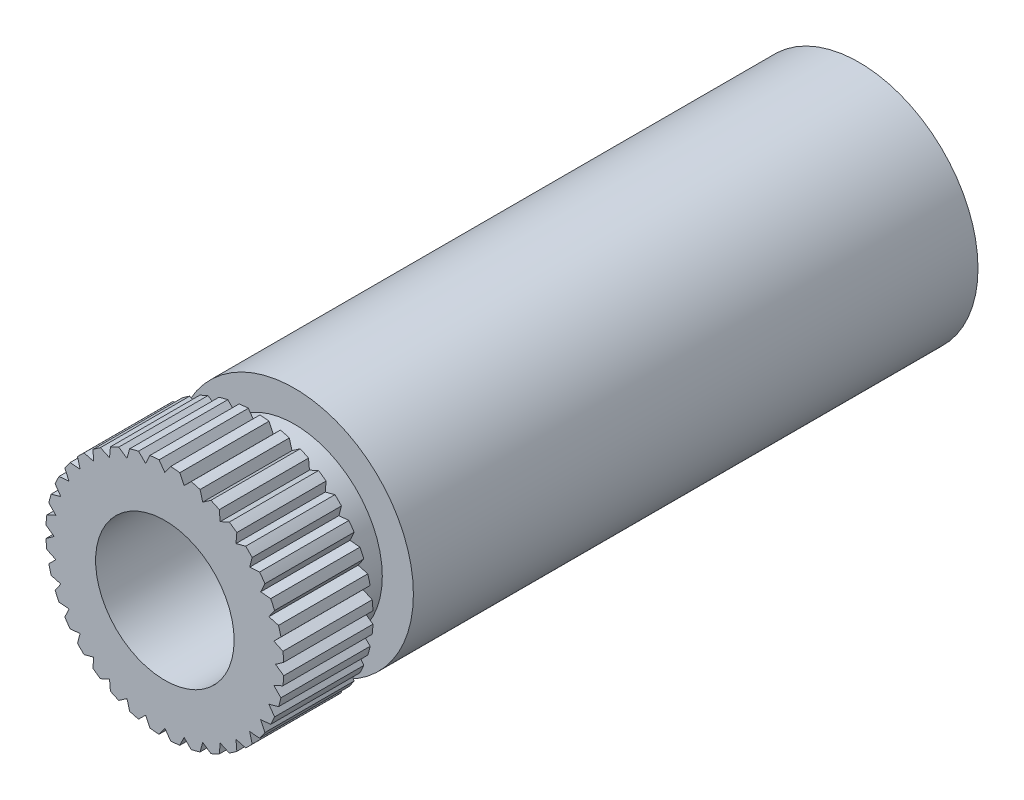
from build123d import *

# Parameters (mm, degrees)
SKETCH1_R           = 6
BOSS_EXTRUDE1_DEPTH = 35
SKETCH4_OUTSIDE_W   = 21.78
SKETCH4_OUTSIDE_H   = 21.78
CUT_EXTRUDE5_DEPTH  = 4.5
SKETCH6_R           = 6.880488524
SKETCH6_R_2         = 4.4323
CUT_EXTRUDE6_DEPTH  = 2.032
SKETCH7_R           = 3.4925
CUT_EXTRUDE7_DEPTH  = 7.112


with BuildPart() as part:
    # Sketch1 → Boss-Extrude1 (new body)
    with BuildSketch(Plane.XY):
        Circle(SKETCH1_R)
    extrude(amount=-BOSS_EXTRUDE1_DEPTH)

    # Sketch4 outside → Cut-Extrude5 (cut)
    with BuildSketch(Plane.XY):
        Rectangle(SKETCH4_OUTSIDE_W, SKETCH4_OUTSIDE_H)
        with BuildLine():
            Line((5.5808372, 0), (5.992919203, 0.291409379))
            ThreePointArc((5.992919203, 0.291409379), (5.977168189, 0.522934456), (5.952476002, 0.753677283))
            Line((5.952476002, 0.753677283), (5.496051743, 0.96910221))
            Line((5.496051743, 0.96910221), (5.851270587, 1.327641714))
            ThreePointArc((5.851270587, 1.327641714), (5.795554958, 1.552914271), (5.73116983, 1.775863842))
            Line((5.73116983, 1.775863842), (5.244271535, 1.908758739))
            Line((5.244271535, 1.908758739), (5.531834074, 2.323534328))
            ThreePointArc((5.531834074, 2.323534328), (5.437846722, 2.53570957), (5.335724962, 2.744091676))
            Line((5.335724962, 2.744091676), (4.83314679, 2.7904186))
            Line((4.83314679, 2.7904186), (5.044315583, 3.248827527))
            ThreePointArc((5.044315583, 3.248827527), (4.914912266, 3.441458618), (4.778156792, 3.628941674))
            Line((4.778156792, 3.628941674), (4.275169325, 3.587293004))
            Line((4.275169325, 3.587293004), (4.403528115, 4.075406745))
            ThreePointArc((4.403528115, 4.075406745), (4.242640687, 4.242640687), (4.075406745, 4.403528115))
            Line((4.075406745, 4.403528115), (3.587293004, 4.275169325))
            Line((3.587293004, 4.275169325), (3.628941674, 4.778156792))
            ThreePointArc((3.628941674, 4.778156792), (3.441458618, 4.914912266), (3.248827527, 5.044315583))
            Line((3.248827527, 5.044315583), (2.7904186, 4.83314679))
            Line((2.7904186, 4.83314679), (2.744091676, 5.335724962))
            ThreePointArc((2.744091676, 5.335724962), (2.53570957, 5.437846722), (2.323534328, 5.531834074))
            Line((2.323534328, 5.531834074), (1.908758739, 5.244271535))
            Line((1.908758739, 5.244271535), (1.775863842, 5.73116983))
            ThreePointArc((1.775863842, 5.73116983), (1.552914271, 5.795554958), (1.327641714, 5.851270587))
            Line((1.327641714, 5.851270587), (0.96910221, 5.496051743))
            Line((0.96910221, 5.496051743), (0.753677283, 5.952476002))
            ThreePointArc((0.753677283, 5.952476002), (0.522934456, 5.977168189), (0.291409379, 5.992919203))
            Line((0.291409379, 5.992919203), (0, 5.5808372))
            Line((0, 5.5808372), (-0.291409379, 5.992919203))
            ThreePointArc((-0.291409379, 5.992919203), (-0.522934456, 5.977168189), (-0.753677283, 5.952476002))
            Line((-0.753677283, 5.952476002), (-0.96910221, 5.496051743))
            Line((-0.96910221, 5.496051743), (-1.327641714, 5.851270587))
            ThreePointArc((-1.327641714, 5.851270587), (-1.552914271, 5.795554958), (-1.775863842, 5.73116983))
            Line((-1.775863842, 5.73116983), (-1.908758739, 5.244271535))
            Line((-1.908758739, 5.244271535), (-2.323534328, 5.531834074))
            ThreePointArc((-2.323534328, 5.531834074), (-2.53570957, 5.437846722), (-2.744091676, 5.335724962))
            Line((-2.744091676, 5.335724962), (-2.7904186, 4.83314679))
            Line((-2.7904186, 4.83314679), (-3.248827527, 5.044315583))
            ThreePointArc((-3.248827527, 5.044315583), (-3.441458618, 4.914912266), (-3.628941674, 4.778156792))
            Line((-3.628941674, 4.778156792), (-3.587293004, 4.275169325))
            Line((-3.587293004, 4.275169325), (-4.075406745, 4.403528115))
            ThreePointArc((-4.075406745, 4.403528115), (-4.242640687, 4.242640687), (-4.403528115, 4.075406745))
            Line((-4.403528115, 4.075406745), (-4.275169325, 3.587293004))
            Line((-4.275169325, 3.587293004), (-4.778156792, 3.628941674))
            ThreePointArc((-4.778156792, 3.628941674), (-4.914912266, 3.441458618), (-5.044315583, 3.248827527))
            Line((-5.044315583, 3.248827527), (-4.83314679, 2.7904186))
            Line((-4.83314679, 2.7904186), (-5.335724962, 2.744091676))
            ThreePointArc((-5.335724962, 2.744091676), (-5.437846722, 2.53570957), (-5.531834074, 2.323534328))
            Line((-5.531834074, 2.323534328), (-5.244271535, 1.908758739))
            Line((-5.244271535, 1.908758739), (-5.73116983, 1.775863842))
            ThreePointArc((-5.73116983, 1.775863842), (-5.795554958, 1.552914271), (-5.851270587, 1.327641714))
            Line((-5.851270587, 1.327641714), (-5.496051743, 0.96910221))
            Line((-5.496051743, 0.96910221), (-5.952476002, 0.753677283))
            ThreePointArc((-5.952476002, 0.753677283), (-5.977168189, 0.522934456), (-5.992919203, 0.291409379))
            Line((-5.992919203, 0.291409379), (-5.5808372, 0))
            Line((-5.5808372, 0), (-5.992919203, -0.291409379))
            ThreePointArc((-5.992919203, -0.291409379), (-5.977168189, -0.522934456), (-5.952476002, -0.753677283))
            Line((-5.952476002, -0.753677283), (-5.496051743, -0.96910221))
            Line((-5.496051743, -0.96910221), (-5.851270587, -1.327641714))
            ThreePointArc((-5.851270587, -1.327641714), (-5.795554958, -1.552914271), (-5.73116983, -1.775863842))
            Line((-5.73116983, -1.775863842), (-5.244271535, -1.908758739))
            Line((-5.244271535, -1.908758739), (-5.531834074, -2.323534328))
            ThreePointArc((-5.531834074, -2.323534328), (-5.437846722, -2.53570957), (-5.335724962, -2.744091676))
            Line((-5.335724962, -2.744091676), (-4.83314679, -2.7904186))
            Line((-4.83314679, -2.7904186), (-5.044315583, -3.248827527))
            ThreePointArc((-5.044315583, -3.248827527), (-4.914912266, -3.441458618), (-4.778156792, -3.628941674))
            Line((-4.778156792, -3.628941674), (-4.275169325, -3.587293004))
            Line((-4.275169325, -3.587293004), (-4.403528115, -4.075406745))
            ThreePointArc((-4.403528115, -4.075406745), (-4.242640687, -4.242640687), (-4.075406745, -4.403528115))
            Line((-4.075406745, -4.403528115), (-3.587293004, -4.275169325))
            Line((-3.587293004, -4.275169325), (-3.628941674, -4.778156792))
            ThreePointArc((-3.628941674, -4.778156792), (-3.441458618, -4.914912266), (-3.248827527, -5.044315583))
            Line((-3.248827527, -5.044315583), (-2.7904186, -4.83314679))
            Line((-2.7904186, -4.83314679), (-2.744091676, -5.335724962))
            ThreePointArc((-2.744091676, -5.335724962), (-2.53570957, -5.437846722), (-2.323534328, -5.531834074))
            Line((-2.323534328, -5.531834074), (-1.908758739, -5.244271535))
            Line((-1.908758739, -5.244271535), (-1.775863842, -5.73116983))
            ThreePointArc((-1.775863842, -5.73116983), (-1.552914271, -5.795554958), (-1.327641714, -5.851270587))
            Line((-1.327641714, -5.851270587), (-0.96910221, -5.496051743))
            Line((-0.96910221, -5.496051743), (-0.753677283, -5.952476002))
            ThreePointArc((-0.753677283, -5.952476002), (-0.522934456, -5.977168189), (-0.291409379, -5.992919203))
            Line((-0.291409379, -5.992919203), (0, -5.5808372))
            Line((0, -5.5808372), (0.291409379, -5.992919203))
            ThreePointArc((0.291409379, -5.992919203), (0.522934456, -5.977168189), (0.753677283, -5.952476002))
            Line((0.753677283, -5.952476002), (0.96910221, -5.496051743))
            Line((0.96910221, -5.496051743), (1.327641714, -5.851270587))
            ThreePointArc((1.327641714, -5.851270587), (1.552914271, -5.795554958), (1.775863842, -5.73116983))
            Line((1.775863842, -5.73116983), (1.908758739, -5.244271535))
            Line((1.908758739, -5.244271535), (2.323534328, -5.531834074))
            ThreePointArc((2.323534328, -5.531834074), (2.53570957, -5.437846722), (2.744091676, -5.335724962))
            Line((2.744091676, -5.335724962), (2.7904186, -4.83314679))
            Line((2.7904186, -4.83314679), (3.248827527, -5.044315583))
            ThreePointArc((3.248827527, -5.044315583), (3.441458618, -4.914912266), (3.628941674, -4.778156792))
            Line((3.628941674, -4.778156792), (3.587293004, -4.275169325))
            Line((3.587293004, -4.275169325), (4.075406745, -4.403528115))
            ThreePointArc((4.075406745, -4.403528115), (4.242640687, -4.242640687), (4.403528115, -4.075406745))
            Line((4.403528115, -4.075406745), (4.275169325, -3.587293004))
            Line((4.275169325, -3.587293004), (4.778156792, -3.628941674))
            ThreePointArc((4.778156792, -3.628941674), (4.914912266, -3.441458618), (5.044315583, -3.248827527))
            Line((5.044315583, -3.248827527), (4.83314679, -2.7904186))
            Line((4.83314679, -2.7904186), (5.335724962, -2.744091676))
            ThreePointArc((5.335724962, -2.744091676), (5.437846722, -2.53570957), (5.531834074, -2.323534328))
            Line((5.531834074, -2.323534328), (5.244271535, -1.908758739))
            Line((5.244271535, -1.908758739), (5.73116983, -1.775863842))
            ThreePointArc((5.73116983, -1.775863842), (5.795554958, -1.552914271), (5.851270587, -1.327641714))
            Line((5.851270587, -1.327641714), (5.496051743, -0.96910221))
            Line((5.496051743, -0.96910221), (5.952476002, -0.753677283))
            ThreePointArc((5.952476002, -0.753677283), (5.977168189, -0.522934456), (5.992919203, -0.291409379))
            Line((5.992919203, -0.291409379), (5.5808372, 0))
        make_face(mode=Mode.SUBTRACT)
    extrude(amount=-CUT_EXTRUDE5_DEPTH, mode=Mode.SUBTRACT)

    # Sketch6 → Cut-Extrude6 (cut)
    with BuildSketch(Plane.XY.offset(-4.5)):
        Circle(SKETCH6_R)
        Circle(SKETCH6_R_2, mode=Mode.SUBTRACT)
    extrude(amount=-CUT_EXTRUDE6_DEPTH, mode=Mode.SUBTRACT)

    # Sketch7 → Cut-Extrude7 (cut)
    with BuildSketch(Plane.XY):
        Circle(SKETCH7_R)
    extrude(amount=-CUT_EXTRUDE7_DEPTH, mode=Mode.SUBTRACT)


solid = part.part
